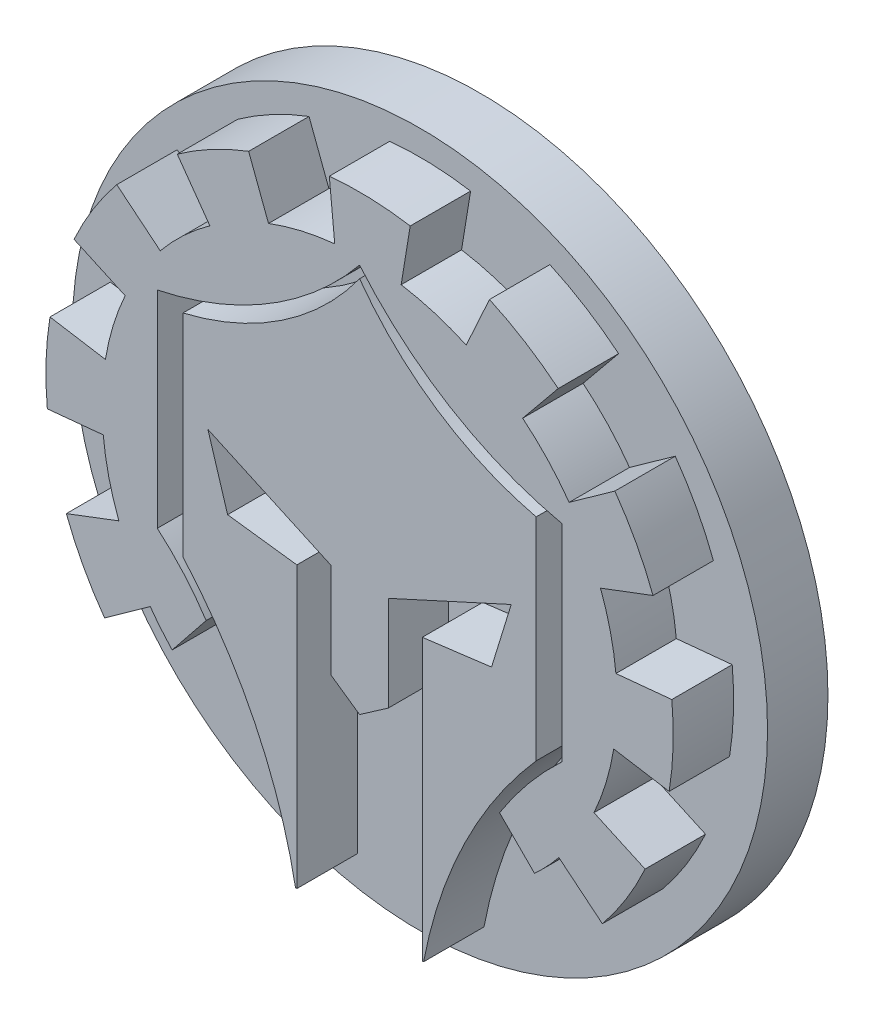
from build123d import *

# Parameters (mm, degrees)
SKETCH1_R               = 13.8795
SKETCH1_R_2             = 13.8811
SKETCH1_R_3             = 2.54
SKETCH1_W               = 163.5125
SKETCH1_H               = 30.6038
BOSS_EXTRUDE1_DEPTH     = 5.08
SKETCH3_W               = 101.6
SKETCH3_H               = 2.54
BOSS_EXTRUDE4_DEPTH     = 38.1
SKETCH7_W               = 7.620008307
SKETCH7_H               = 5.08
BOSS_EXTRUDE5_DEPTH     = 11.43
FILLET5_RADIUS          = 3.810004153
FILLET5_LENGTH          = 5.08
BOSS_EXTRUDE6_DEPTH     = 2.54
SKETCH15_R              = 1.8415
BOSS_EXTRUDE7_DEPTH     = 2.54
CUT_EXTRUDE3_START      = -5.08
SKETCH19_R              = 1.8415
CUT_EXTRUDE3_DEPTH      = 5.08
SKETCH12_W              = 155.030782426
SKETCH12_H              = 26.837151361
CUT_EXTRUDE4_DEPTH      = 229.935471644
CUT_EXTRUDE5_DEPTH      = 2.54
FILLET6_R               = 2.54
BOSS_EXTRUDE8_DEPTH     = 5.08
CUT_EXTRUDE6_DEPTH      = 186.437362631
CUT_EXTRUDE6_DEPTH_BACK = 186.437362631
SKETCH23_R              = 1.8415
SKETCH25_W              = 130.43271363
SKETCH25_H              = 56.644769142
SKETCH25_R              = 14.617659747
CUT_EXTRUDE8_DEPTH      = 158.1898379


with BuildPart() as part:
    # Sketch1 → Boss-Extrude1 (new body)
    with BuildSketch(Plane(origin=(0, 0, 0), x_dir=(1, 0, 0), z_dir=(0, 1, 0))):
        with BuildLine():
            Line((0, 0), (201.6125, 0))
            Line((201.6125, 0), (201.6125, -45.847))
            Line((201.6125, -45.847), (166.66845, -45.847))
            Line((166.66845, -45.847), (166.66845, -83.7692))
            ThreePointArc((166.66845, -83.7692), (162.204757345, -94.545507345), (151.42845, -99.0092))
            Line((151.42845, -99.0092), (50.18405, -99.0092))
            ThreePointArc((50.18405, -99.0092), (39.407742655, -94.545507345), (34.94405, -83.7692))
            Line((34.94405, -83.7692), (34.94405, -45.847))
            Line((34.94405, -45.847), (0, -45.847))
            Line((0, -45.847), (0, 0))
        make_face()
        with Locations(Location((60.34405, -72.4265, 0), (0, 0, 270))):
            Circle(SKETCH1_R, mode=Mode.SUBTRACT)
        with Locations(Location((141.26845, -72.4281, 0), (0, 0, 270))):
            Circle(SKETCH1_R_2, mode=Mode.SUBTRACT)
        with Locations(Location((13.096875, -9.7139, 0), (0, 0, 270))):
            Circle(SKETCH1_R_3, mode=Mode.SUBTRACT)
        with Locations(Location((188.515625, -9.7139, 0), (0, 0, 270))):
            Circle(SKETCH1_R_3, mode=Mode.SUBTRACT)
        with Locations(Location((13.096875, -36.1299, 0), (0, 0, 270))):
            Circle(SKETCH1_R_3, mode=Mode.SUBTRACT)
        with Locations(Location((188.515625, -36.1299, 0), (0, 0, 270))):
            Circle(SKETCH1_R_3, mode=Mode.SUBTRACT)
        with Locations(Location((100.80625, -72.4281, 0), (0, 0, 270))):
            Circle(SKETCH1_R_2, mode=Mode.SUBTRACT)
        with Locations((100.80625, -22.9219)):
            Rectangle(SKETCH1_W, SKETCH1_H, mode=Mode.SUBTRACT)
    extrude(amount=BOSS_EXTRUDE1_DEPTH)

    # Sketch3 → Boss-Extrude4 (add)
    with BuildSketch(Plane(origin=(0, 0, 198.0184), x_dir=(-1, 0, 0), z_dir=(0, 1, 0))):
        with Locations((-100.80625, -100.2792)):
            Rectangle(SKETCH3_W, SKETCH3_H)
    extrude(amount=-BOSS_EXTRUDE4_DEPTH)

    # Sketch7 → Boss-Extrude5 (add)
    with BuildSketch(Plane(origin=(0, 0, 99.0092), x_dir=(1, 0, 0), z_dir=(0, 0, -1))):
        with Locations((100.806245847, 35.56)):
            Rectangle(SKETCH7_W, SKETCH7_H)
    extrude(amount=BOSS_EXTRUDE5_DEPTH)

    # Fillet5: full round fillet: the end face becomes a half cylinder, R = half its width
    fillet5_face = Plane((100.806245847, -35.56, 87.5792), x_dir=(0, 1, 0), z_dir=(0, 0, -1))  # on the end face: x along it, z out of the body
    fillet5_slab = fillet5_face.offset(-FILLET5_RADIUS / 2) * Box(FILLET5_LENGTH, 2 * FILLET5_RADIUS, FILLET5_RADIUS, mode=Mode.PRIVATE)  # the body's end, R deep
    fillet5_round = Plane((100.806245847, -35.56, 91.389204153), x_dir=(0, 0, -1), z_dir=(0, 1, 0)) * Cylinder(FILLET5_RADIUS, FILLET5_LENGTH, mode=Mode.PRIVATE)  # its axis R under the face
    add(fillet5_slab - fillet5_round, mode=Mode.SUBTRACT)

    # Sketch14 → Boss-Extrude6 (add)
    with BuildSketch(Plane(origin=(0, 0, 99.0092), x_dir=(-1, 0, 0), z_dir=(0, 0, -1))):
        with BuildLine():
            Line((-106.692297799, -23.852483199), (-108.165059803, -25.325245202))
            ThreePointArc((-108.165059803, -25.325245202), (-108.695299399, -24.799048835), (-109.188003193, -24.237551179))
            Line((-109.188003193, -24.237551179), (-111.016232612, -25.73340078))
            ThreePointArc((-111.016232612, -25.73340078), (-112.008576056, -24.346487635), (-112.813712744, -22.843148519))
            Line((-112.813712744, -22.843148519), (-110.663621263, -21.864835961))
            ThreePointArc((-110.663621263, -21.864835961), (-111.169570673, -20.523896068), (-111.494018753, -19.127888173))
            Line((-111.494018753, -19.127888173), (-113.825236675, -19.509217219))
            ThreePointArc((-113.825236675, -19.509217219), (-113.991174734, -17.81194348), (-113.936774001, -16.107445271))
            Line((-113.936774001, -16.107445271), (-111.585583879, -16.335247483))
            ThreePointArc((-111.585583879, -16.335247483), (-111.353278975, -14.920984767), (-110.936255307, -13.549782426))
            Line((-110.936255307, -13.549782426), (-113.145813772, -12.714414106))
            ThreePointArc((-113.145813772, -12.714414106), (-112.440883477, -11.161562901), (-111.541521956, -9.712624518))
            Line((-111.541521956, -9.712624518), (-109.619232687, -11.085502082))
            ThreePointArc((-109.619232687, -11.085502082), (-108.71091938, -9.976867094), (-107.664165119, -8.997882867))
            Line((-107.664165119, -8.997882867), (-109.160014721, -7.169653447))
            ThreePointArc((-109.160014721, -7.169653447), (-107.773101576, -6.177310003), (-106.26976246, -5.372173315))
            Line((-106.26976246, -5.372173315), (-105.291449901, -7.522264796))
            ThreePointArc((-105.291449901, -7.522264796), (-103.950510009, -7.016315387), (-102.554502114, -6.691867307))
            Line((-102.554502114, -6.691867307), (-102.93583116, -4.360649385))
            ThreePointArc((-102.93583116, -4.360649385), (-101.238557421, -4.194711325), (-99.534059212, -4.249112058))
            Line((-99.534059212, -4.249112058), (-99.761861424, -6.600302181))
            ThreePointArc((-99.761861424, -6.600302181), (-98.347598708, -6.832607085), (-96.976396367, -7.249630753))
            Line((-96.976396367, -7.249630753), (-96.141028047, -5.040072288))
            ThreePointArc((-96.141028047, -5.040072288), (-94.588176842, -5.745002582), (-93.139238459, -6.644364103))
            Line((-93.139238459, -6.644364103), (-94.512116023, -8.566653372))
            ThreePointArc((-94.512116023, -8.566653372), (-93.403481035, -9.474966679), (-92.424496807, -10.52172094))
            Line((-92.424496807, -10.52172094), (-90.596267388, -9.025871338))
            ThreePointArc((-90.596267388, -9.025871338), (-89.603923944, -10.412784483), (-88.798787256, -11.9161236))
            Line((-88.798787256, -11.9161236), (-90.948878737, -12.894436158))
            ThreePointArc((-90.948878737, -12.894436158), (-90.442929327, -14.23537605), (-90.118481247, -15.631383945))
            Line((-90.118481247, -15.631383945), (-87.787263325, -15.250054899))
            ThreePointArc((-87.787263325, -15.250054899), (-87.621325266, -16.947328638), (-87.675725999, -18.651826847))
            Line((-87.675725999, -18.651826847), (-90.026916121, -18.424024635))
            ThreePointArc((-90.026916121, -18.424024635), (-90.261418035, -19.847693028), (-90.683092324, -21.227553033))
            Line((-90.683092324, -21.227553033), (-88.475027465, -22.066861331))
            ThreePointArc((-88.475027465, -22.066861331), (-89.182726542, -23.618452644), (-90.084671181, -25.065784483))
            Line((-90.084671181, -25.065784483), (-92.004508517, -23.689480212))
            ThreePointArc((-92.004508517, -23.689480212), (-92.446198552, -24.26398978), (-92.925321338, -24.807674144))
            Line((-92.925321338, -24.807674144), (-94.354515121, -23.023521367))
            ThreePointArc((-94.354515121, -23.023521367), (-93.409906556, -21.784451479), (-92.300984022, -20.689978846))
            Line((-92.300984022, -20.689978846), (-92.300984022, -12.009378674))
            ThreePointArc((-92.300984022, -12.009378674), (-96.99616691, -10.159066764), (-100.80625, -6.84973702))
            ThreePointArc((-100.80625, -6.84973702), (-104.633502919, -10.130984342), (-109.311759392, -12.009378674))
            Line((-109.311759392, -12.009378674), (-109.311759392, -20.689978846))
            ThreePointArc((-109.311759392, -20.689978846), (-107.900903874, -22.187470719), (-106.692297799, -23.852483199))
        make_face()
        with BuildLine():
            Line((-100.80625, -23.220768427), (-99.599369927, -22.380573493))
            Line((-99.599369927, -22.380573493), (-99.599369927, -18.3831432))
            Line((-99.599369927, -18.3831432), (-94.428037288, -16.022579614))
            Line((-94.428037288, -16.022579614), (-95.257330485, -18.716255471))
            Line((-95.257330485, -18.716255471), (-98.169049816, -19.087499686))
            Line((-98.169049816, -19.087499686), (-98.169049816, -30.877249674))
            Line((-98.169049816, -30.877249674), (-98.113370072, -30.877249674))
            ThreePointArc((-98.113370072, -30.877249674), (-96.397994117, -25.717029016), (-93.380333496, -21.193300875))
            Line((-93.380333496, -21.193300875), (-93.380333496, -12.307821257))
            ThreePointArc((-93.380333496, -12.307821257), (-97.539082277, -10.495406691), (-100.80625, -7.348081946))
            ThreePointArc((-100.80625, -7.348081946), (-104.073417723, -10.495406691), (-108.232166504, -12.307821257))
            Line((-108.232166504, -12.307821257), (-108.232166504, -21.193300875))
            ThreePointArc((-108.232166504, -21.193300875), (-105.214505883, -25.717029016), (-103.499129928, -30.877249674))
            Line((-103.499129928, -30.877249674), (-103.443450184, -30.877249674))
            Line((-103.443450184, -30.877249674), (-103.443450184, -19.087499686))
            Line((-103.443450184, -19.087499686), (-106.355169515, -18.716255471))
            Line((-106.355169515, -18.716255471), (-107.184462712, -16.022579614))
            Line((-107.184462712, -16.022579614), (-102.013130073, -18.3831432))
            Line((-102.013130073, -18.3831432), (-102.013130073, -22.380573493))
            Line((-102.013130073, -22.380573493), (-100.80625, -23.220768427))
        make_face()
    extrude(amount=-BOSS_EXTRUDE6_DEPTH)

    # Sketch15 → Boss-Extrude7 (add)
    # profile 1 of 2: a face of its own
    with BuildSketch(Plane.XZ):
        with BuildLine():
            Line((114.68735, 88.8492), (114.68735, 96.4692))
            Line((114.68735, 96.4692), (127.38735, 96.4692))
            Line((127.38735, 96.4692), (127.38735, 88.8492))
            ThreePointArc((127.38735, 88.8492), (121.03735, 82.4992), (114.68735, 88.8492))
        make_face()
        with Locations(Location((121.03735, 88.8492, 0), (0, 0, 270))):
            Circle(SKETCH15_R, mode=Mode.SUBTRACT)
    # profile 2 of 2: a face of its own
    with BuildSketch(Plane.XZ):
        with BuildLine():
            Line((74.22515, 96.4692), (86.92515, 96.4692))
            Line((86.92515, 96.4692), (86.92515, 88.8492))
            ThreePointArc((86.92515, 88.8492), (80.57515, 82.4992), (74.22515, 88.8492))
            Line((74.22515, 88.8492), (74.22515, 96.4692))
        make_face()
        with Locations(Location((80.57515, 88.8492, 0), (0, 0, 90))):
            Circle(SKETCH15_R, mode=Mode.SUBTRACT)
    extrude(amount=BOSS_EXTRUDE7_DEPTH)

    # Sketch19 → Cut-Extrude3 (cut)
    with BuildSketch(Plane.XZ.offset(CUT_EXTRUDE3_START)):
        with Locations(Location((80.57515, 88.8492, 0), (0, 0, 90))):
            Circle(SKETCH19_R)
        with Locations(Location((121.03735, 88.8492, 0), (0, 0, 270))):
            Circle(SKETCH19_R)
    extrude(amount=CUT_EXTRUDE3_DEPTH, mode=Mode.SUBTRACT)

    # Sketch12 → Cut-Extrude4 (cut, through all)
    with BuildSketch(Plane(origin=(201.6125, 0, 0), x_dir=(0, 0, -1), z_dir=(1, 0, 0))):
        with Locations((-77.515391213, 13.418575681)):
            Rectangle(SKETCH12_W, SKETCH12_H)
    extrude(amount=-CUT_EXTRUDE4_DEPTH, mode=Mode.SUBTRACT)

    # Sketch21 → Cut-Extrude5 (cut)
    with BuildSketch(Plane.XY.offset(99.0092)):
        Polygon((55.08625, -33.02), (55.08625, -25.835795103), (62.270454897, -33.02), align=None)
        Polygon((55.08625, -5.08), (55.883069587, -5.08), (83.823069587, -33.02), (76.638864691, -33.02), (55.08625, -11.467385309), align=None)
        with BuildLine():
            Line((91.916241693, -33.02), (91.916241693, -30.737077601))
            ThreePointArc((91.916241693, -30.737077601), (89.237970167, -28.421401444), (87.1450505, -25.565673567))
            Line((87.1450505, -25.565673567), (66.659376933, -5.08))
            Line((66.659376933, -5.08), (59.475172036, -5.08))
            Line((59.475172036, -5.08), (87.415172036, -33.02))
            Line((87.415172036, -33.02), (91.916241693, -33.02))
        make_face()
        Polygon((146.52625, -5.08), (145.729430413, -5.08), (117.789430413, -33.02), (124.973635309, -33.02), (146.52625, -11.467385309), align=None)
        with BuildLine():
            Line((109.69625, -33.02), (114.197327964, -33.02))
            Line((114.197327964, -33.02), (142.137327964, -5.08))
            Line((142.137327964, -5.08), (134.953123067, -5.08))
            Line((134.953123067, -5.08), (114.4674495, -25.565673567))
            ThreePointArc((114.4674495, -25.565673567), (112.374526421, -28.421405143), (109.69625, -30.737083287))
            Line((109.69625, -30.737083287), (109.69625, -33.02))
        make_face()
        Polygon((146.52625, -33.02), (146.52625, -25.835795103), (139.342045103, -33.02), align=None)
        Polygon((135.749942655, -33.02), (146.52625, -22.243692655), (146.52625, -15.059487758), (128.565737758, -33.02), align=None)
        with BuildLine():
            Line((124.176815722, -5.08), (115.916182775, -13.340632947))
            ThreePointArc((115.916182775, -13.340632947), (116.509577502, -16.678871551), (116.374281129, -20.06673949))
            Line((116.374281129, -20.06673949), (131.361020619, -5.08))
            Line((131.361020619, -5.08), (124.176815722, -5.08))
        make_face()
        with BuildLine():
            Line((120.584713274, -5.08), (114.907893678, -10.756819596))
            ThreePointArc((114.907893678, -10.756819596), (113.575134343, -8.545454533), (111.89877754, -6.581730837))
            Line((111.89877754, -6.581730837), (113.400508377, -5.08))
            Line((113.400508377, -5.08), (120.584713274, -5.08))
        make_face()
        Polygon((65.862557345, -33.02), (55.08625, -22.243692655), (55.08625, -15.059487758), (73.046762242, -33.02), align=None)
        with BuildLine():
            Line((70.251479381, -5.08), (85.238218871, -20.06673949))
            ThreePointArc((85.238218871, -20.06673949), (85.102922498, -16.678871551), (85.696317225, -13.340632947))
            Line((85.696317225, -13.340632947), (77.435684278, -5.08))
            Line((77.435684278, -5.08), (70.251479381, -5.08))
        make_face()
        with BuildLine():
            Line((81.027786726, -5.08), (86.704606322, -10.756819596))
            ThreePointArc((86.704606322, -10.756819596), (88.037365657, -8.545454533), (89.71372246, -6.581730837))
            Line((89.71372246, -6.581730837), (88.211991623, -5.08))
            Line((88.211991623, -5.08), (81.027786726, -5.08))
        make_face()
    extrude(amount=-CUT_EXTRUDE5_DEPTH, mode=Mode.SUBTRACT)

    # Fillet6
    fillet6_edges = [part.edges().sort_by_distance(p)[0] for p in [
        (151.60625, -19.05, 99.0092),
        (50.00625, -19.05, 99.0092),
    ]]
    fillet(fillet6_edges, radius=FILLET6_R - 0.0001)  # a hair under: the kernel refuses the full size

    # Sketch22 → Boss-Extrude8 (add)
    with BuildSketch(Plane(origin=(0, -33.02, 0), x_dir=(1, 0, 0), z_dir=(0, 1, 0))):
        with BuildLine():
            Line((94.45625, -96.4692), (94.45625, -88.8492))
            ThreePointArc((94.45625, -88.8492), (100.80625, -82.4992), (107.15625, -88.8492))
            Line((107.15625, -88.8492), (107.15625, -96.4692))
            Line((107.15625, -96.4692), (94.45625, -96.4692))
        make_face()
    extrude(amount=-BOSS_EXTRUDE8_DEPTH)

    # Sketch23 → Cut-Extrude6 (cut, two sides: drawn at the far end of the back side and taken through both)
    with BuildSketch(Plane(origin=(0, -33.02, 0), x_dir=(1, 0, 0), z_dir=(0, 1, 0)).offset(-CUT_EXTRUDE6_DEPTH_BACK)):
        with Locations(Location((100.80625, -88.8492, 0), (0, 0, 270))):
            Circle(SKETCH23_R)
    extrude(amount=CUT_EXTRUDE6_DEPTH + CUT_EXTRUDE6_DEPTH_BACK, mode=Mode.SUBTRACT)

    # Sketch25 → Cut-Extrude8 (cut, through all)
    with BuildSketch(Plane.XY.offset(99.0092)):
        with Locations((92.75102303, -12.285674788)):
            Rectangle(SKETCH25_W, SKETCH25_H)
        with Locations((100.80625, -17.748386051)):
            Circle(SKETCH25_R, mode=Mode.SUBTRACT)
    extrude(amount=-CUT_EXTRUDE8_DEPTH, mode=Mode.SUBTRACT)


solid = part.part
